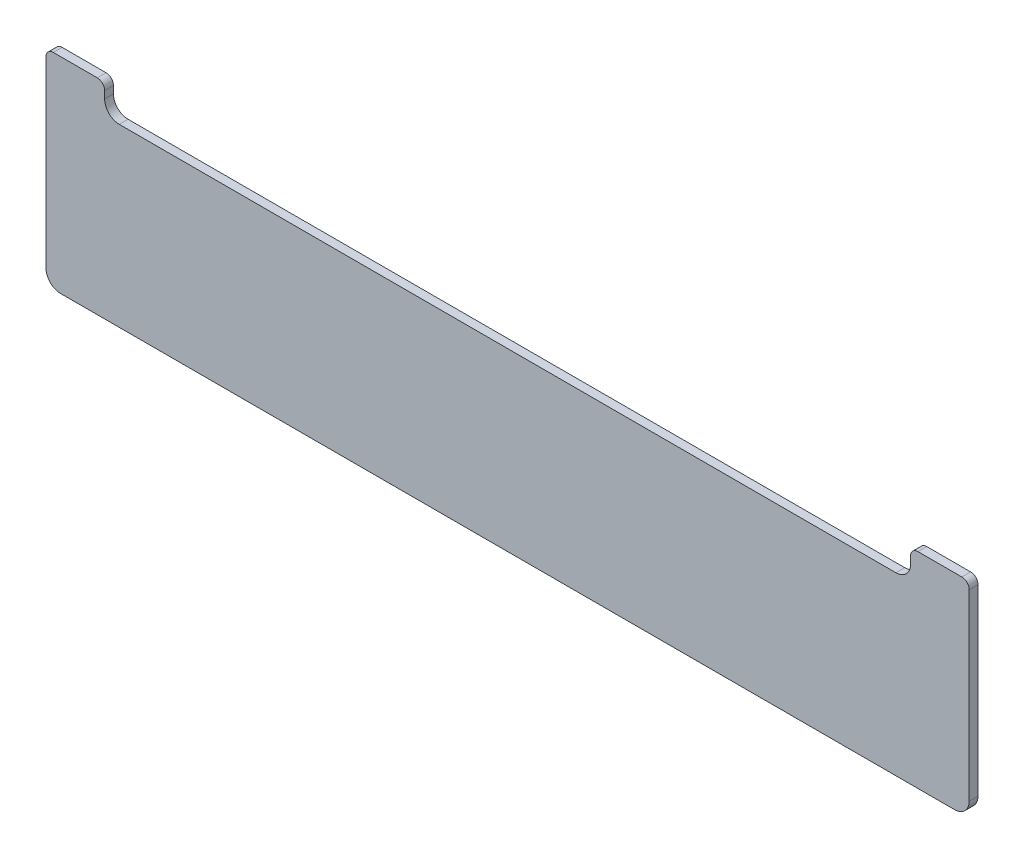
from build123d import *

# Parameters (mm, degrees)
SKETCH1_W           = 315
SKETCH1_H           = 70
BOSS_EXTRUDE1_DEPTH = 3
SKETCH2_W           = 275
SKETCH2_H           = 10
CUT_EXTRUDE1_DEPTH  = 3
FILLET1_R           = 5
FILLET2_R           = 2.5


with BuildPart() as part:
    # Sketch1 → Boss-Extrude1 (new body)
    with BuildSketch(Plane.XY):
        Rectangle(SKETCH1_W, SKETCH1_H)
    extrude(amount=BOSS_EXTRUDE1_DEPTH)

    # Sketch2 → Cut-Extrude1 (cut)
    with BuildSketch(Plane.XY.offset(3)):
        with Locations((0, 30)):
            Rectangle(SKETCH2_W, SKETCH2_H)
    extrude(amount=-CUT_EXTRUDE1_DEPTH, mode=Mode.SUBTRACT)

    # Fillet1
    fillet1_edges = [part.edges().sort_by_distance(p)[0] for p in [
        (137.5, 25, 1.5),
        (-137.5, 25, 1.5),
        (157.5, -35, 1.5),
        (-157.5, -35, 1.5),
    ]]
    fillet(fillet1_edges, radius=FILLET1_R)

    # Fillet2
    fillet2_edges = [part.edges().sort_by_distance(p)[0] for p in [
        (137.5, 35, 1.5),
        (157.5, 35, 1.5),
        (-157.5, 35, 1.5),
        (-137.5, 35, 1.5),
    ]]
    fillet(fillet2_edges, radius=FILLET2_R)


solid = part.part
